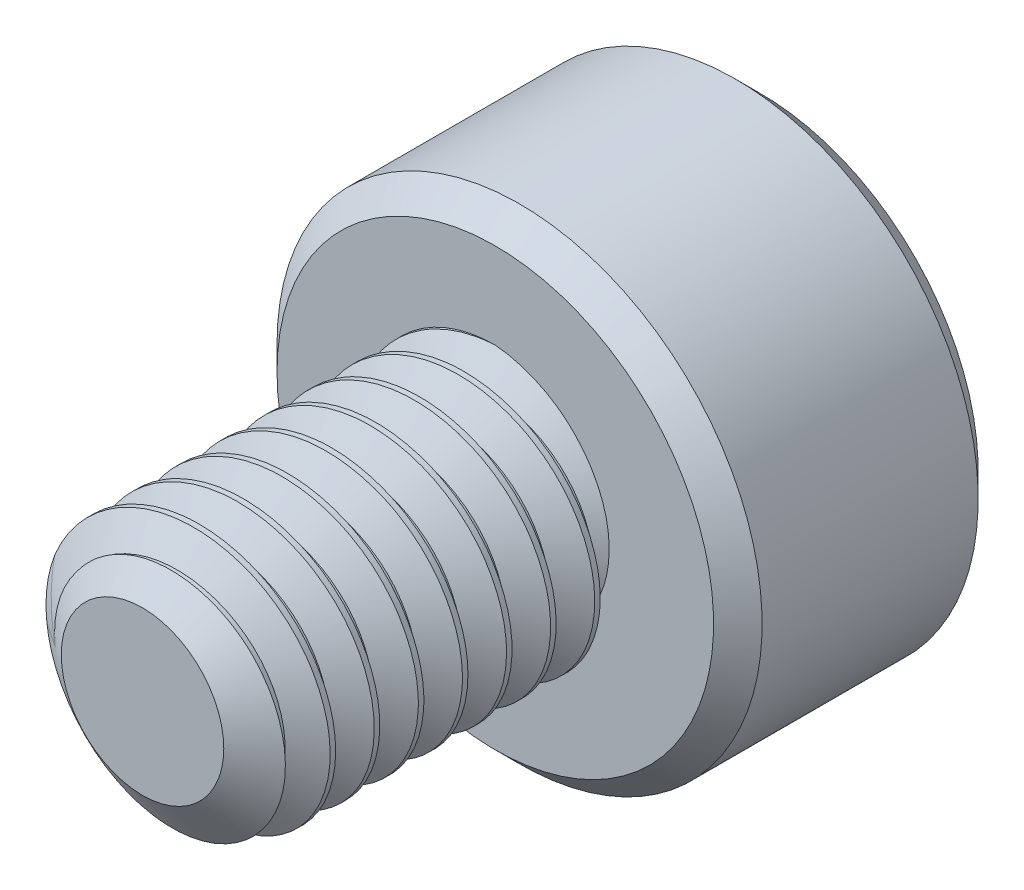
from build123d import *

# Parameters (mm, degrees)
SKETCH1_R          = 1.5
EXTRUDE1_DEPTH     = 4
CUT_SWEEP1_PITCH   = 0.5
SKETCH6_R          = 2.75
EXTRUDE2_DEPTH     = 3
CUT_EXTRUDE1_DEPTH = 1.875
CHAMFER1_SIZE      = 0.275


with BuildPart() as part:
    # Sketch1 → Extrude1 (new body)
    with BuildSketch(Plane.XY):
        Circle(SKETCH1_R)
    extrude(amount=-EXTRUDE1_DEPTH)

    # Cut-Sweep1: the profile of Sketch3 profile screwed along a right-hand helix of 9 turns, 6 arcs to a turn; built about Z, then put on its axis
    cut_sweep1_z = Axis((0, 0, 0), (0, 0, 1))
    cut_sweep1_corners = [(1.5003, 0, -0.437673205), (1.175240474, 0, -0.25), (1.175240474, 0, -0.1875), (1.5003, 0, 0.000173205)]
    with BuildLine(mode=Mode.PRIVATE) as cut_sweep1_profile:
        Line(cut_sweep1_corners[0], cut_sweep1_corners[1])
        Line(cut_sweep1_corners[1], cut_sweep1_corners[2])
        Line(cut_sweep1_corners[2], cut_sweep1_corners[3])
        Line(cut_sweep1_corners[3], cut_sweep1_corners[0])
    cut_sweep1_cap = Face(cut_sweep1_profile.wire())
    cut_sweep1_turn_angles = [0, 30, 60, 90, 120, 150, 180, 210, 240, 270, 300, 330, 360]
    cut_sweep1_turn_weights = [1, 0.8660254037844387, 1, 0.8660254037844387, 1, 0.8660254037844387, 1, 0.8660254037844387, 1, 0.8660254037844387, 1, 0.8660254037844387, 1]
    cut_sweep1_turn_rails = [Edge.make_bspline([Vector(p[0], p[1], 0).rotate(cut_sweep1_z, cut_sweep1_turn_angles[k]) / cut_sweep1_turn_weights[k] + Vector(0, 0, p[2] + CUT_SWEEP1_PITCH * cut_sweep1_turn_angles[k] / 360) for k in range(13)], [0, 0, 0, 1, 1, 2, 2, 3, 3, 4, 4, 5, 5, 6, 6, 6], 2, cut_sweep1_turn_weights) for p in cut_sweep1_corners]
    cut_sweep1_turn_sides = [Face.make_surface_from_curves(cut_sweep1_turn_rails[p[0]], cut_sweep1_turn_rails[p[1]]) for p in [(0, 1), (1, 2), (2, 3), (3, 0)]]
    cut_sweep1 = Plane(origin=(0, 0, 0), x_dir=(0, 1, 0), z_dir=(0, 0, -1)) * Solid(Shell([*[p.moved(Location((0, 0, CUT_SWEEP1_PITCH * i))) for i in range(9) for p in cut_sweep1_turn_sides], cut_sweep1_cap, cut_sweep1_cap.rotate(cut_sweep1_z, 3240).moved(Location((0, 0, CUT_SWEEP1_PITCH * 3240 / 360)))]))
    add(cut_sweep1, mode=Mode.SUBTRACT)

    # Sketch4 → Cut-Revolve1 (revolve, cut)
    with BuildSketch(Plane(origin=(0, 0, 0), x_dir=(0, 0, -1), z_dir=(1, 0, 0)), mode=Mode.PRIVATE) as cut_revolve1_sk:
        Polygon((0.405251783, 1.5), (0, 0.921240474), (0, 1.5), align=None)
    revolve(cut_revolve1_sk.sketch.rotate(Axis((0, 0, 0), (0, 0, -1)), 263.352109169), axis=Axis((0, 0, 0), (0, 0, -1)), mode=Mode.SUBTRACT)

    # Sketch6 → Extrude2 (add)
    with BuildSketch(Plane(origin=(0, 0, -4), x_dir=(-1, 0, 0), z_dir=(0, 0, -1))):
        Circle(SKETCH6_R)
    extrude(amount=EXTRUDE2_DEPTH)

    # Sketch7 → Cut-Extrude1 (cut)
    with BuildSketch(Plane(origin=(0, 0, -7), x_dir=(-1, 0, 0), z_dir=(0, 0, -1))):
        Polygon((0, 1.443375673), (-1.25, 0.721687836), (-1.25, -0.721687836), (0, -1.443375673), (1.25, -0.721687836), (1.25, 0.721687836), align=None)
    extrude(amount=-CUT_EXTRUDE1_DEPTH, mode=Mode.SUBTRACT)

    # Cut-Extrude2 cone 1 section (through the dimple's axis) → Cut-Extrude2 (revolve, cut)
    with BuildSketch(Plane(origin=(0, 0, -7), x_dir=(0, 1, 0), z_dir=(1, 0, 0))):
        Polygon((0, 0), (1.443375673, 0), (0, 1.443375673), align=None)
    revolve(axis=Axis((0, 0, -7), (0, 0, 1)), mode=Mode.SUBTRACT)

    # Chamfer1
    chamfer1_edges = [part.edges().sort_by_distance(p)[0] for p in [
        (2.75, 0, -4),
        (2.75, 0, -7),
    ]]
    chamfer(chamfer1_edges, length=CHAMFER1_SIZE)


solid = part.part
